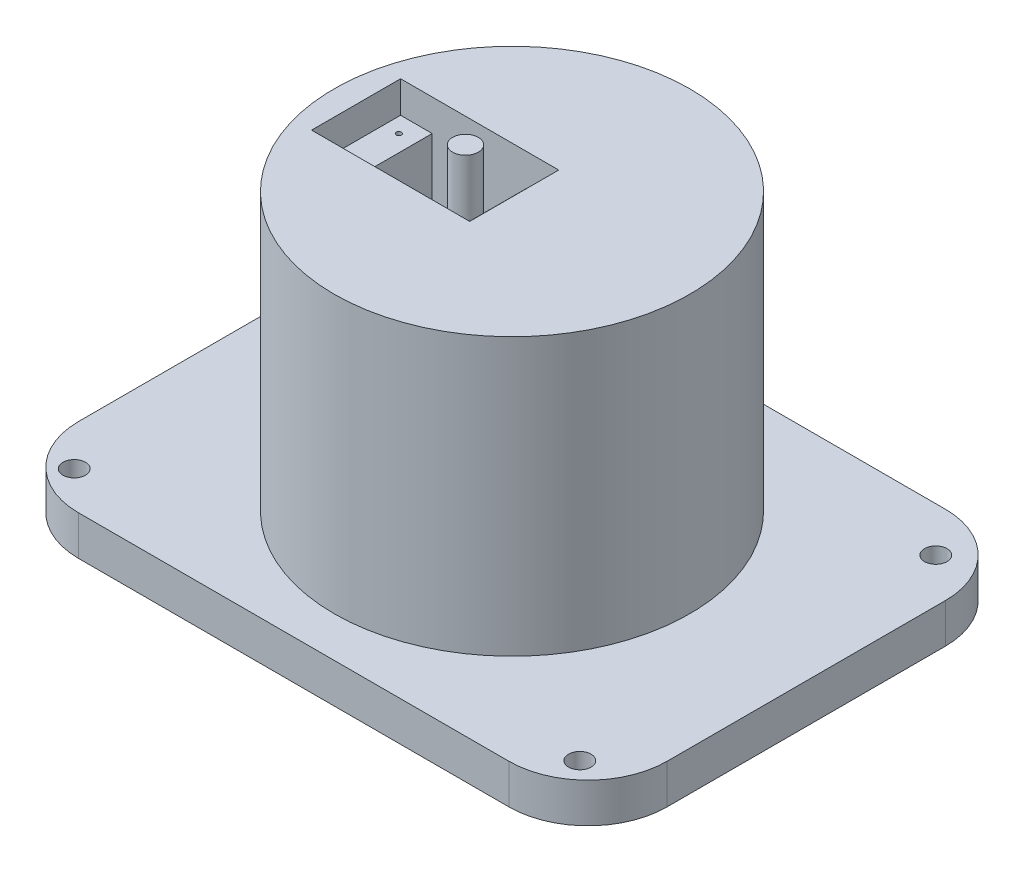
from build123d import *

# Parameters (mm, degrees)
BOSS_EXTRUDE2_DEPTH = 10
SKETCH3_R           = 45
BOSS_EXTRUDE3_DEPTH = 70
SKETCH5_W           = 40
SKETCH5_H           = 22.516210705
CUT_EXTRUDE1_DEPTH  = 40
SKETCH6_W           = 8.00117247
SKETCH6_H           = 22.516210705
SKETCH6_W_2         = 8.041819545
BOSS_EXTRUDE4_DEPTH = 32
SKETCH8_R           = 0.656937265
SKETCH8_R_2         = 0.65
CUT_EXTRUDE2_DEPTH  = 6
SHELL16_START       = 10
SHELL16_DEPTH       = 60
SHELL16_2_DEPTH     = 20
SHELL16_START_2     = 30
SHELL16_3_OUTLINE_W = 8.041819545
SHELL16_3_OUTLINE_H = 42.516210705
SHELL16_3_DEPTH     = 26
SHELL16_START_3     = 56
SHELL16_4_DEPTH     = 6
SKETCH9_R           = 2.85
CUT_EXTRUDE3_DEPTH  = 6
SKETCH10_R          = 3.25
BOSS_EXTRUDE5_DEPTH = 45


# Read off the part's stored shape, not the designer's step: Shell16
with BuildPart() as part:
    # Sketch2 → Boss-Extrude2 (new body)
    with BuildSketch(Plane(origin=(0, 0, 0), x_dir=(1, 0, 0), z_dir=(0, 1, 0))):
        with BuildLine():
            Line((-54.435630286, 55.212655463), (54.435630286, 55.212655463))
            ThreePointArc((54.435630286, 55.212655463), (68.577765909, 49.354791087), (74.435630286, 35.212655463))
            Line((74.435630286, 35.212655463), (74.435630286, -35.212655463))
            ThreePointArc((74.435630286, -35.212655463), (68.577765909, -49.354791087), (54.435630286, -55.212655463))
            Line((54.435630286, -55.212655463), (-54.435630286, -55.212655463))
            ThreePointArc((-54.435630286, -55.212655463), (-68.577765909, -49.354791087), (-74.435630286, -35.212655463))
            Line((-74.435630286, -35.212655463), (-74.435630286, 35.212655463))
            ThreePointArc((-74.435630286, 35.212655463), (-68.577765909, 49.354791087), (-54.435630286, 55.212655463))
        make_face()
    extrude(amount=BOSS_EXTRUDE2_DEPTH)

    # Sketch3 → Boss-Extrude3 (add)
    with BuildSketch(Plane(origin=(0, 10, 0), x_dir=(1, 0, 0), z_dir=(0, 1, 0))):
        with Locations(Location((0, 0, 0), (0, 0, 270))):
            Circle(SKETCH3_R)
    extrude(amount=BOSS_EXTRUDE3_DEPTH)

    # Sketch5 → Cut-Extrude1 (cut)
    with BuildSketch(Plane(origin=(0, 80, 0), x_dir=(1, 0, 0), z_dir=(0, 1, 0))):
        with Locations((-18.795917007, -0.647948509)):
            Rectangle(SKETCH5_W, SKETCH5_H)
    extrude(amount=-CUT_EXTRUDE1_DEPTH, mode=Mode.SUBTRACT)

    # Sketch6 → Boss-Extrude4 (add)
    with BuildSketch(Plane(origin=(0, 40, 0), x_dir=(1, 0, 0), z_dir=(0, 1, 0))):
        with Locations((-34.795330772, -0.647948509)):
            Rectangle(SKETCH6_W, SKETCH6_H)
        with Locations((-2.81682678, -0.647948509)):
            Rectangle(SKETCH6_W_2, SKETCH6_H)
    extrude(amount=BOSS_EXTRUDE4_DEPTH)

    # Sketch8 → Cut-Extrude2 (cut)
    with BuildSketch(Plane(origin=(0, 72, 0), x_dir=(1, 0, 0), z_dir=(0, 1, 0))):
        with Locations(Location((-3.150273661, 6.373412823, 0), (0, 0, 270))):
            Circle(SKETCH8_R)
        with Locations(Location((-3.150273661, -7.089946011, 0), (0, 0, 270))):
            Circle(SKETCH8_R_2)
        with Locations(Location((-34.990160193, 6.373412823, 0), (0, 0, 270))):
            Circle(SKETCH8_R_2)
        with Locations(Location((-34.990160193, -7.089946011, 0), (0, 0, 270))):
            Circle(SKETCH8_R_2)
    extrude(amount=-CUT_EXTRUDE2_DEPTH, mode=Mode.SUBTRACT)

    # Shell16 outline → Shell16 (cut)
    with BuildSketch(Plane(origin=(0, 0, 0), x_dir=(1, 0, 0), z_dir=(0, 1, 0)).offset(SHELL16_START)):
        with BuildLine():
            ThreePointArc((-27.296974268, -21.906053862), (34.990492106, 0.815758643), (-28.28818543, 20.610156843))
            Line((-28.28818543, 20.610156843), (11.204082993, 20.610156843))
            Line((11.204082993, 20.610156843), (11.204082993, -21.906053862))
            Line((11.204082993, -21.906053862), (-27.296974268, -21.906053862))
        make_face()
    extrude(amount=SHELL16_DEPTH, mode=Mode.SUBTRACT)

    # Shell16 2 outline → Shell16 2 (cut)
    with BuildSketch(Plane(origin=(0, 0, 0), x_dir=(1, 0, 0), z_dir=(0, 1, 0)).offset(SHELL16_START)):
        with BuildLine():
            ThreePointArc((-28.28818543, 20.610156843), (-34.990492106, -0.815758643), (-27.296974268, -21.906053862))
            Line((-27.296974268, -21.906053862), (11.204082993, -21.906053862))
            Line((11.204082993, -21.906053862), (11.204082993, 20.610156843))
            Line((11.204082993, 20.610156843), (-28.28818543, 20.610156843))
        make_face()
    extrude(amount=SHELL16_2_DEPTH, mode=Mode.SUBTRACT)

    # Shell16 3 outline → Shell16 3 (cut)
    with BuildSketch(Plane(origin=(0, 0, 0), x_dir=(1, 0, 0), z_dir=(0, 1, 0)).offset(SHELL16_START_2)):
        with Locations((7.183173221, -0.647948509)):
            Rectangle(SHELL16_3_OUTLINE_W, SHELL16_3_OUTLINE_H)
    extrude(amount=SHELL16_3_DEPTH, mode=Mode.SUBTRACT)

    # Shell16 4 outline → Shell16 4 (cut)
    with BuildSketch(Plane(origin=(0, 0, 0), x_dir=(1, 0, 0), z_dir=(0, 1, 0)).offset(SHELL16_START_3)):
        with BuildLine():
            Line((11.204082993, 20.610156843), (3.162263448, 20.610156843))
            Line((3.162263448, 20.610156843), (3.162263448, 14.95957536))
            ThreePointArc((3.162263448, 14.95957536), (7.421869806, 7.715088784), (5.106897043, -0.363756008))
            ThreePointArc((5.106897043, -0.363756008), (7.414773238, -8.432437732), (3.162263448, -15.667496667))
            Line((3.162263448, -15.667496667), (3.162263448, -21.906053862))
            Line((3.162263448, -21.906053862), (11.204082993, -21.906053862))
            Line((11.204082993, -21.906053862), (11.204082993, 20.610156843))
        make_face()
    extrude(amount=SHELL16_4_DEPTH, mode=Mode.SUBTRACT)

    # Sketch9 → Cut-Extrude3 (cut)
    with BuildSketch(Plane(origin=(0, 10, 0), x_dir=(1, 0, 0), z_dir=(0, 1, 0))):
        with Locations(Location((-64.63637004, 43.938587161, 0), (0, 0, 270))):
            Circle(SKETCH9_R)
        with Locations(Location((63.260769817, 43.938587161, 0), (0, 0, 270))):
            Circle(SKETCH9_R)
        with Locations(Location((-64.63637004, -46.106335294, 0), (0, 0, 270))):
            Circle(SKETCH9_R)
        with Locations(Location((63.260769817, -46.106335294, 0), (0, 0, 270))):
            Circle(SKETCH9_R)
    extrude(amount=-CUT_EXTRUDE3_DEPTH, mode=Mode.SUBTRACT)

    # Sketch10 → Boss-Extrude5 (add)
    with BuildSketch(Plane(origin=(0, 40, 0), x_dir=(1, 0, 0), z_dir=(0, 1, 0))):
        with Locations(Location((-11.127628751, -0.64794851, 0), (0, 0, 270))):
            Circle(SKETCH10_R)
    extrude(amount=BOSS_EXTRUDE5_DEPTH)


solid = part.part
